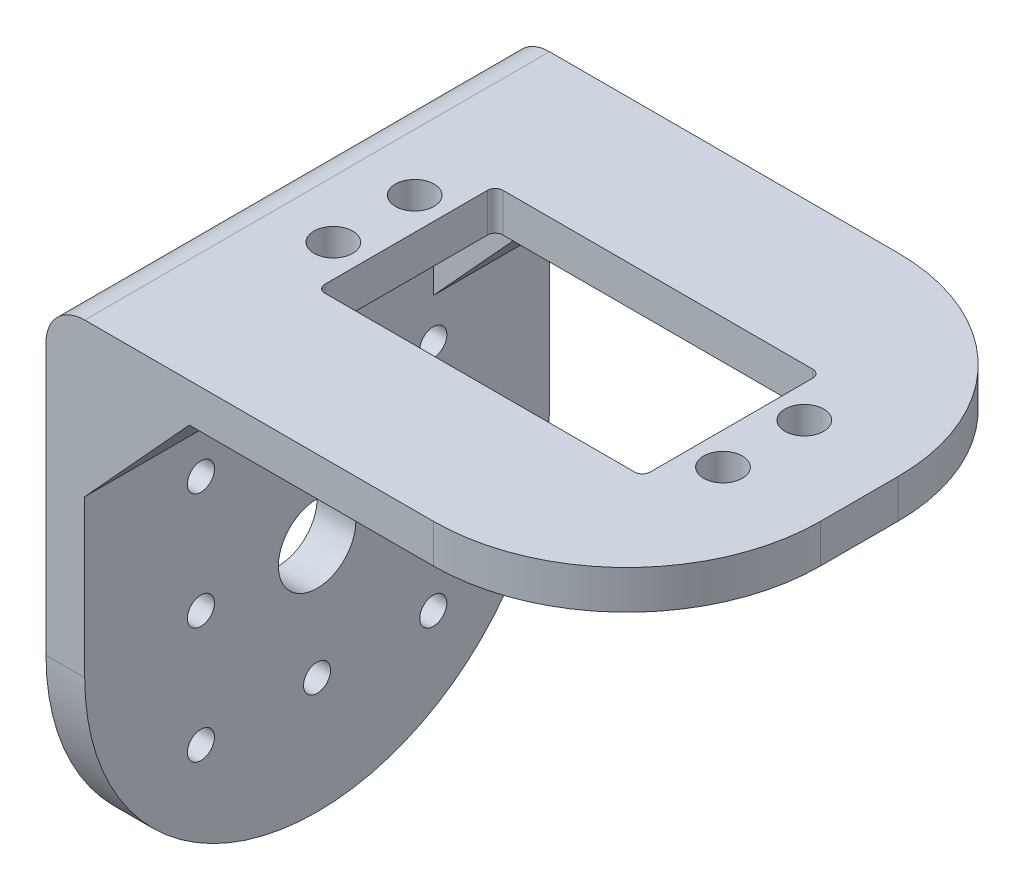
from build123d import *

# Parameters (mm, degrees)
BOSS_EXTRUDE1_DEPTH = 5
CUT_EXTRUDE1_REACH  = 58.403
SKETCH2_R           = 1.75
SKETCH4_W           = 75
SKETCH4_H           = 60
BOSS_EXTRUDE2_DEPTH = 5
CUT_EXTRUDE2_REACH  = 90.459
SKETCH3_R           = 2.5
SKETCH3_W           = 23
SKETCH3_H           = 42
FILLET1_R           = 25
FILLET2_R           = 5
FILLET3_R           = 2
FILLET4_R           = 1
BOSS_EXTRUDE3_DEPTH = 15
LPATTERN1_COUNT     = 2
LPATTERN1_PITCH     = 45
CUT_EXTRUDE3_REACH  = 95.708
SKETCH7_R           = 5


with BuildPart() as part:
    # Sketch1 → Boss-Extrude1 (new body)
    with BuildSketch(Plane(origin=(0, 0, 0), x_dir=(0, 0, -1), z_dir=(1, 0, 0))):
        with BuildLine():
            ThreePointArc((-30, -17.5), (0, -47.5), (30, -17.5))
            Line((30, -17.5), (30, 17.5))
            Line((30, 17.5), (-30, 17.5))
            Line((-30, 17.5), (-30, -17.5))
        make_face()
    extrude(amount=BOSS_EXTRUDE1_DEPTH)

    # Sketch2 → Cut-Extrude1 (cut, up to next)
    with BuildSketch(Plane(origin=(5, 0, 0), x_dir=(0, 0, -1), z_dir=(1, 0, 0)), mode=Mode.PRIVATE) as cut_extrude1_sk1:
        with Locations((-15, -32.5)):
            Circle(SKETCH2_R)
    cut_extrude1_tool1 = extrude(cut_extrude1_sk1.sketch, amount=-CUT_EXTRUDE1_REACH, mode=Mode.PRIVATE) & part.part
    # Sketch2 → Cut-Extrude1 (cut, up to next)
    with BuildSketch(Plane(origin=(5, 0, 0), x_dir=(0, 0, -1), z_dir=(1, 0, 0)), mode=Mode.PRIVATE) as cut_extrude1_sk2:
        with Locations((15, -32.5)):
            Circle(SKETCH2_R)
    cut_extrude1_tool2 = extrude(cut_extrude1_sk2.sketch, amount=-CUT_EXTRUDE1_REACH, mode=Mode.PRIVATE) & part.part
    # Sketch2 → Cut-Extrude1 (cut, up to next)
    with BuildSketch(Plane(origin=(5, 0, 0), x_dir=(0, 0, -1), z_dir=(1, 0, 0)), mode=Mode.PRIVATE) as cut_extrude1_sk3:
        with Locations((-15, -2.5)):
            Circle(SKETCH2_R)
    cut_extrude1_tool3 = extrude(cut_extrude1_sk3.sketch, amount=-CUT_EXTRUDE1_REACH, mode=Mode.PRIVATE) & part.part
    # Sketch2 → Cut-Extrude1 (cut, up to next)
    with BuildSketch(Plane(origin=(5, 0, 0), x_dir=(0, 0, -1), z_dir=(1, 0, 0)), mode=Mode.PRIVATE) as cut_extrude1_sk4:
        with Locations((0, -2.5)):
            Circle(SKETCH2_R)
    cut_extrude1_tool4 = extrude(cut_extrude1_sk4.sketch, amount=-CUT_EXTRUDE1_REACH, mode=Mode.PRIVATE) & part.part
    # Sketch2 → Cut-Extrude1 (cut, up to next)
    with BuildSketch(Plane(origin=(5, 0, 0), x_dir=(0, 0, -1), z_dir=(1, 0, 0)), mode=Mode.PRIVATE) as cut_extrude1_sk5:
        with Locations((15, -2.5)):
            Circle(SKETCH2_R)
    cut_extrude1_tool5 = extrude(cut_extrude1_sk5.sketch, amount=-CUT_EXTRUDE1_REACH, mode=Mode.PRIVATE) & part.part
    # Sketch2 → Cut-Extrude1 (cut, up to next)
    with BuildSketch(Plane(origin=(5, 0, 0), x_dir=(0, 0, -1), z_dir=(1, 0, 0)), mode=Mode.PRIVATE) as cut_extrude1_sk6:
        with Locations((0, -32.5)):
            Circle(SKETCH2_R)
    cut_extrude1_tool6 = extrude(cut_extrude1_sk6.sketch, amount=-CUT_EXTRUDE1_REACH, mode=Mode.PRIVATE) & part.part
    # Sketch2 → Cut-Extrude1 (cut, up to next)
    with BuildSketch(Plane(origin=(5, 0, 0), x_dir=(0, 0, -1), z_dir=(1, 0, 0)), mode=Mode.PRIVATE) as cut_extrude1_sk7:
        with Locations((-15, -17.5)):
            Circle(SKETCH2_R)
    cut_extrude1_tool7 = extrude(cut_extrude1_sk7.sketch, amount=-CUT_EXTRUDE1_REACH, mode=Mode.PRIVATE) & part.part
    # Sketch2 → Cut-Extrude1 (cut, up to next)
    with BuildSketch(Plane(origin=(5, 0, 0), x_dir=(0, 0, -1), z_dir=(1, 0, 0)), mode=Mode.PRIVATE) as cut_extrude1_sk8:
        with Locations((15, -17.5)):
            Circle(SKETCH2_R)
    cut_extrude1_tool8 = extrude(cut_extrude1_sk8.sketch, amount=-CUT_EXTRUDE1_REACH, mode=Mode.PRIVATE) & part.part
    add(cut_extrude1_tool1.solids().sort_by_distance((5, -32.5, 15))[0], mode=Mode.SUBTRACT)
    add(cut_extrude1_tool2.solids().sort_by_distance((5, -32.5, -15))[0], mode=Mode.SUBTRACT)
    add(cut_extrude1_tool3.solids().sort_by_distance((5, -2.5, 15))[0], mode=Mode.SUBTRACT)
    add(cut_extrude1_tool4.solids().sort_by_distance((5, -2.5, 0))[0], mode=Mode.SUBTRACT)
    add(cut_extrude1_tool5.solids().sort_by_distance((5, -2.5, -15))[0], mode=Mode.SUBTRACT)
    add(cut_extrude1_tool6.solids().sort_by_distance((5, -32.5, 0))[0], mode=Mode.SUBTRACT)
    add(cut_extrude1_tool7.solids().sort_by_distance((5, -17.5, 15))[0], mode=Mode.SUBTRACT)
    add(cut_extrude1_tool8.solids().sort_by_distance((5, -17.5, -15))[0], mode=Mode.SUBTRACT)

    # Sketch4 → Boss-Extrude2 (add)
    with BuildSketch(Plane(origin=(0, 17.5, 0), x_dir=(1, 0, 0), z_dir=(0, 1, 0))):
        with Locations((37.5, 0)):
            Rectangle(SKETCH4_W, SKETCH4_H)
    extrude(amount=BOSS_EXTRUDE2_DEPTH)

    # Sketch3 → Cut-Extrude2 (cut, up to next)
    with BuildSketch(Plane(origin=(30, 22.5, 0), x_dir=(0, 0, -1), z_dir=(0, 1, 0)), mode=Mode.PRIVATE) as cut_extrude2_sk1:
        with Locations((-5.25, 17.65)):
            Circle(SKETCH3_R)
    cut_extrude2_tool1 = extrude(cut_extrude2_sk1.sketch, amount=-CUT_EXTRUDE2_REACH, mode=Mode.PRIVATE) & part.part
    # Sketch3 → Cut-Extrude2 (cut, up to next)
    with BuildSketch(Plane(origin=(30, 22.5, 0), x_dir=(0, 0, -1), z_dir=(0, 1, 0)), mode=Mode.PRIVATE) as cut_extrude2_sk2:
        with Locations((5.25, 17.65)):
            Circle(SKETCH3_R)
    cut_extrude2_tool2 = extrude(cut_extrude2_sk2.sketch, amount=-CUT_EXTRUDE2_REACH, mode=Mode.PRIVATE) & part.part
    # Sketch3 → Cut-Extrude2 (cut, up to next)
    with BuildSketch(Plane(origin=(30, 22.5, 0), x_dir=(0, 0, -1), z_dir=(0, 1, 0)), mode=Mode.PRIVATE) as cut_extrude2_sk3:
        with Locations((5.25, -32.65)):
            Circle(SKETCH3_R)
    cut_extrude2_tool3 = extrude(cut_extrude2_sk3.sketch, amount=-CUT_EXTRUDE2_REACH, mode=Mode.PRIVATE) & part.part
    # Sketch3 → Cut-Extrude2 (cut, up to next)
    with BuildSketch(Plane(origin=(30, 22.5, 0), x_dir=(0, 0, -1), z_dir=(0, 1, 0)), mode=Mode.PRIVATE) as cut_extrude2_sk4:
        with Locations((-5.25, -32.65)):
            Circle(SKETCH3_R)
    cut_extrude2_tool4 = extrude(cut_extrude2_sk4.sketch, amount=-CUT_EXTRUDE2_REACH, mode=Mode.PRIVATE) & part.part
    # Sketch3 → Cut-Extrude2 (cut, up to next)
    with BuildSketch(Plane(origin=(30, 22.5, 0), x_dir=(0, 0, -1), z_dir=(0, 1, 0)), mode=Mode.PRIVATE) as cut_extrude2_sk5:
        with Locations((0, -7.5)):
            Rectangle(SKETCH3_W, SKETCH3_H)
    cut_extrude2_tool5 = extrude(cut_extrude2_sk5.sketch, amount=-CUT_EXTRUDE2_REACH, mode=Mode.PRIVATE) & part.part
    add(cut_extrude2_tool1.solids().sort_by_distance((12.35, 22.5, 5.25))[0], mode=Mode.SUBTRACT)
    add(cut_extrude2_tool2.solids().sort_by_distance((12.35, 22.5, -5.25))[0], mode=Mode.SUBTRACT)
    add(cut_extrude2_tool3.solids().sort_by_distance((62.65, 22.5, -5.25))[0], mode=Mode.SUBTRACT)
    add(cut_extrude2_tool4.solids().sort_by_distance((62.65, 22.5, 5.25))[0], mode=Mode.SUBTRACT)
    add(cut_extrude2_tool5.solids().sort_by_distance((37.5, 22.5, 0))[0], mode=Mode.SUBTRACT)

    # Fillet1
    fillet1_edges = [part.edges().sort_by_distance(p)[0] for p in [
        (75, 20, -30),
        (75, 20, 30),
    ]]
    fillet(fillet1_edges, radius=FILLET1_R)

    # Fillet2
    fillet2_edges = [part.edges().sort_by_distance(p)[0] for p in [
        (0, 22.5, 0),
    ]]
    fillet(fillet2_edges, radius=FILLET2_R)

    # Fillet3
    fillet3_edges = [part.edges().sort_by_distance(p)[0] for p in [
        (5, 17.5, 0),
    ]]
    fillet(fillet3_edges, radius=FILLET3_R)

    # Fillet4
    fillet4_edges = [part.edges().sort_by_distance(p)[0] for p in [
        (16.5, 20, -11.5),
        (58.5, 20, -11.5),
        (58.5, 20, 11.5),
        (16.5, 20, 11.5),
    ]]
    fillet(fillet4_edges, radius=FILLET4_R)

    # Sketch6 → Boss-Extrude3 (add)
    with BuildSketch(Plane.XY.offset(30)):
        Polygon((18.5, 17.5), (5, 2.743645437), (5, 17.5), align=None)
    boss_extrude3 = extrude(amount=-BOSS_EXTRUDE3_DEPTH)

    # LPattern1: Boss-Extrude3 ×2
    with Locations(*[(0, 0, -i * LPATTERN1_PITCH) for i in range(1, LPATTERN1_COUNT)]):
        add(boss_extrude3)

    # Sketch7 → Cut-Extrude3 (cut, up to next)
    with BuildSketch(Plane.ZY, mode=Mode.PRIVATE) as cut_extrude3_sk1:
        with Locations((0, -17.5)):
            Circle(SKETCH7_R)
    cut_extrude3_tool1 = extrude(cut_extrude3_sk1.sketch, amount=-CUT_EXTRUDE3_REACH, mode=Mode.PRIVATE) & part.part
    add(cut_extrude3_tool1.solids().sort_by_distance((0, -17.5, 0))[0], mode=Mode.SUBTRACT)


solid = part.part
